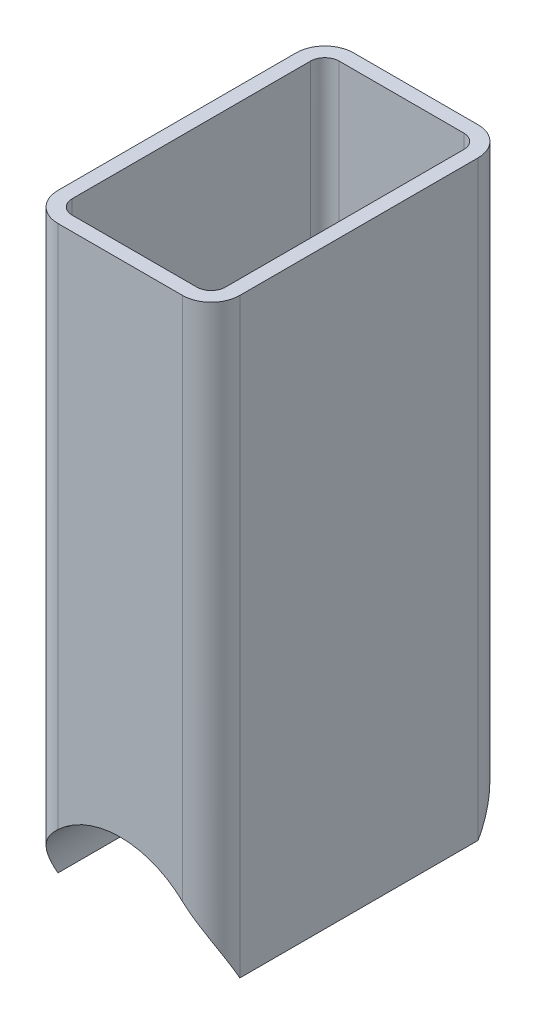
from build123d import *

# Parameters (mm, degrees)
AUFSATZ_LINEAR_AUSTRAGEN1_DEPTH      = 260
SCHNITT_LINEAR_AUSTRAGEN1_DEPTH      = 271.9704780967846
SCHNITT_LINEAR_AUSTRAGEN1_DEPTH_BACK = 271.9704780967846
SKIZZE2_R                            = 40


with BuildPart() as part:
    # Skizze1 → Aufsatz-Linear austragen1 (new body)
    with BuildSketch(Plane(origin=(0, 0, 0), x_dir=(1, 0, 0), z_dir=(0, 1, 0))):
        with BuildLine():
            Line((-27.399999999999988, -65), (27.400000000000016, -65.00000000000001))
            ThreePointArc((27.400000000000016, -65.00000000000001), (36.30954544295052, -61.30954544295051), (40.00000000000002, -52.400000000000006))
            Line((40.00000000000002, -52.400000000000006), (40, 52.400000000000006))
            ThreePointArc((40, 52.400000000000006), (36.309545442950494, 61.30954544295051), (27.4, 65))
            Line((27.4, 65), (-27.399999999999995, 64.99999999999997))
            ThreePointArc((-27.399999999999995, 64.99999999999997), (-36.30954544295047, 61.30954544295047), (-39.99999999999999, 52.39999999999999))
            Line((-39.99999999999999, 52.39999999999999), (-39.999999999999986, -52.400000000000006))
            ThreePointArc((-39.999999999999986, -52.400000000000006), (-36.30954544295049, -61.3095454429505), (-27.399999999999988, -65))
        make_face()
        with BuildLine():
            Line((-27.39999999999999, -58.7), (27.400000000000016, -58.7))
            ThreePointArc((27.400000000000016, -58.7), (31.854772721475264, -56.85477272147525), (33.70000000000002, -52.400000000000006))
            Line((33.70000000000002, -52.400000000000006), (33.7, 52.400000000000006))
            ThreePointArc((33.7, 52.400000000000006), (31.854772721475253, 56.85477272147526), (27.400000000000002, 58.7))
            Line((27.400000000000002, 58.7), (-27.39999999999999, 58.7))
            ThreePointArc((-27.39999999999999, 58.7), (-31.854772721475243, 56.85477272147526), (-33.69999999999999, 52.400000000000006))
            Line((-33.69999999999999, 52.400000000000006), (-33.69999999999999, -52.400000000000006))
            ThreePointArc((-33.69999999999999, -52.400000000000006), (-31.85477272147524, -56.85477272147525), (-27.39999999999999, -58.7))
        make_face(mode=Mode.SUBTRACT)
    extrude(amount=AUFSATZ_LINEAR_AUSTRAGEN1_DEPTH)

    # Skizze2 → Schnitt-Linear austragen1 (cut, two sides: drawn at the far end of the back side and taken through both)
    with BuildSketch(Plane.XY.offset(-SCHNITT_LINEAR_AUSTRAGEN1_DEPTH_BACK)):
        Circle(SKIZZE2_R)
    extrude(amount=SCHNITT_LINEAR_AUSTRAGEN1_DEPTH + SCHNITT_LINEAR_AUSTRAGEN1_DEPTH_BACK, mode=Mode.SUBTRACT)


solid = part.part
